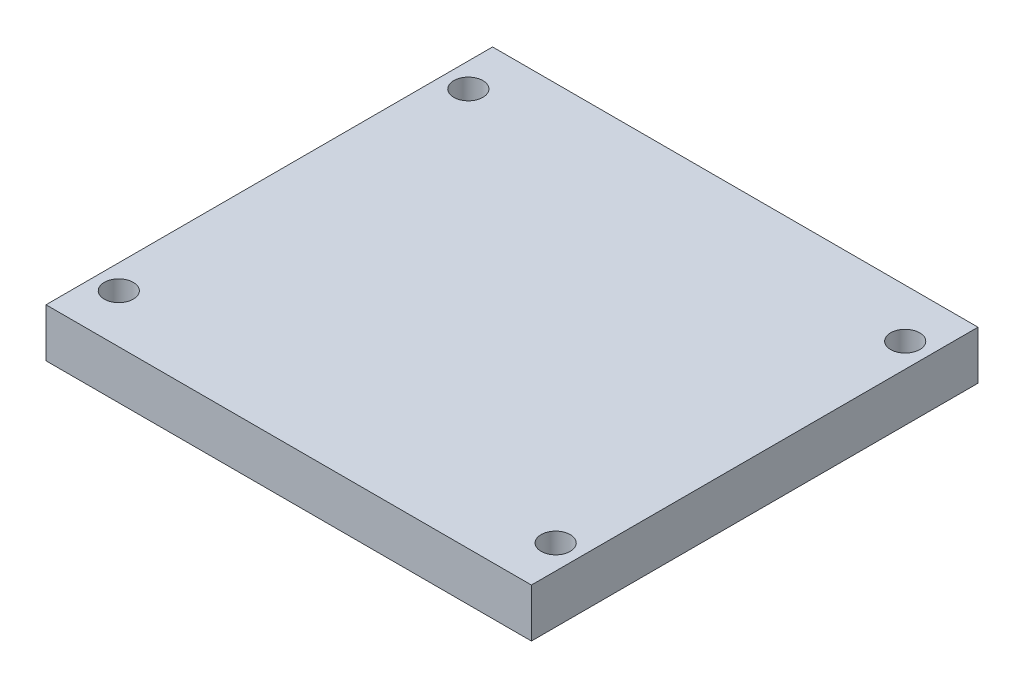
from build123d import *

# Parameters (mm, degrees)
SKETCH1_W           = 25
SKETCH1_H           = 46
SKETCH1_R           = 1.5
BOSS_EXTRUDE1_DEPTH = 5


with BuildPart() as part:
    # Sketch1 → Boss-Extrude1 (new body)
    with BuildSketch(Plane(origin=(0, 0, 0), x_dir=(1, 0, 0), z_dir=(0, 1, 0))):
        with Locations((12.5, 23)):
            Rectangle(SKETCH1_W, SKETCH1_H)
        with Locations((22.5, 5)):
            Circle(SKETCH1_R, mode=Mode.SUBTRACT)
        with Locations((22.5, 41)):
            Circle(SKETCH1_R, mode=Mode.SUBTRACT)
    boss_extrude1 = extrude(amount=BOSS_EXTRUDE1_DEPTH)

    # Mirror1: Boss-Extrude1 across plane
    add(boss_extrude1.mirror(Plane(origin=(0, 5, 0), x_dir=(0, 0, 1), z_dir=(1, 0, 0))))


solid = part.part
